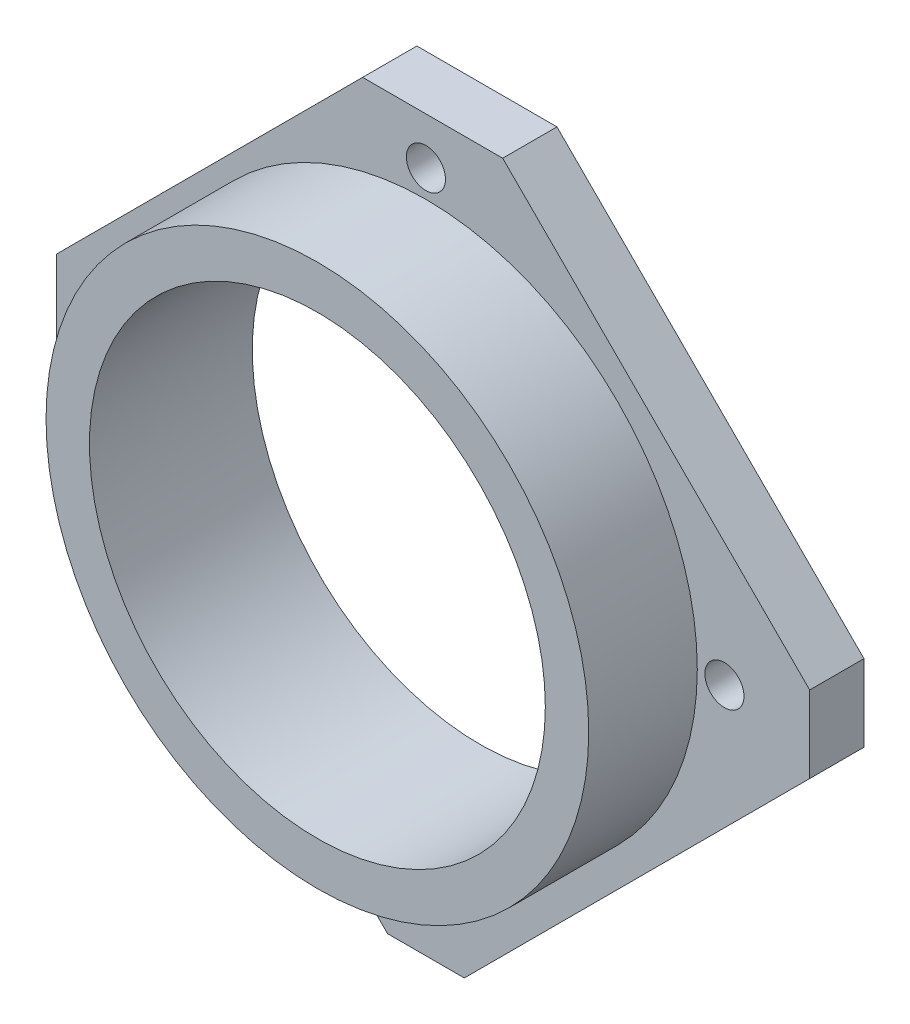
from build123d import *

# Parameters (mm, degrees)
SKETCH1_R           = 1.8
SKETCH1_R_2         = 21
BOSS_EXTRUDE1_DEPTH = 5
SKETCH2_R           = 25
SKETCH2_R_2         = 21
BOSS_EXTRUDE2_DEPTH = 10


with BuildPart() as part:
    # Sketch1 → Boss-Extrude1 (new body)
    with BuildSketch(Plane.XY):
        Polygon((-34.029102601, -4.861770365), (-3.535533906, -35.355339059), (3.535533906, -35.355339059), (35.355339059, -3.535533906), (35.355339059, 3.535533906), (7.071067812, 31.819805153), (-5.832808457, 31.819805153), (-34.029102601, 3.62351101), align=None)
        with Locations((0, -27.5)):
            Circle(SKETCH1_R, mode=Mode.SUBTRACT)
        with Locations((-27.5, 0)):
            Circle(SKETCH1_R, mode=Mode.SUBTRACT)
        Circle(SKETCH1_R_2, mode=Mode.SUBTRACT)
        with Locations((0, 27.5)):
            Circle(SKETCH1_R, mode=Mode.SUBTRACT)
        with Locations((27.5, 0)):
            Circle(SKETCH1_R, mode=Mode.SUBTRACT)
    extrude(amount=BOSS_EXTRUDE1_DEPTH)

    # Sketch2 → Boss-Extrude2 (add)
    with BuildSketch(Plane.XY.offset(5)):
        Circle(SKETCH2_R)
        Circle(SKETCH2_R_2, mode=Mode.SUBTRACT)
    extrude(amount=BOSS_EXTRUDE2_DEPTH)


solid = part.part
